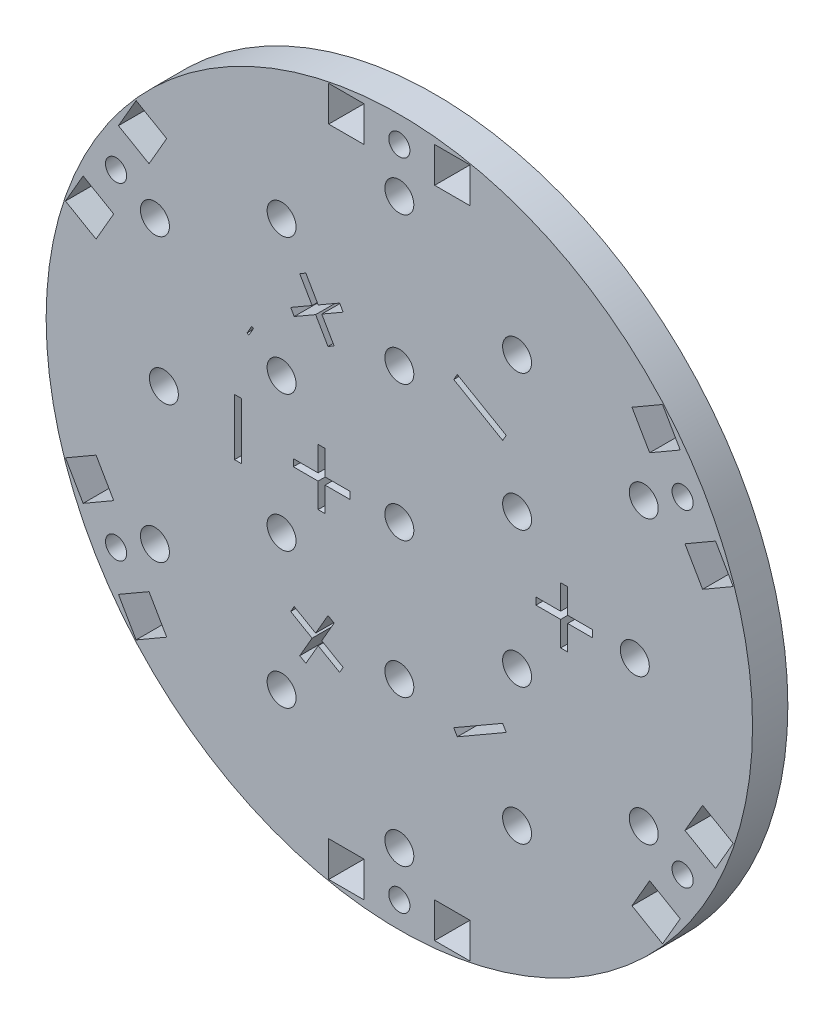
from build123d import *

# Parameters (mm, degrees)
BOSS_EXTRU_1_OUTLINE_R   = 50
BOSS_EXTRU_1_OUTLINE_W   = 5
BOSS_EXTRU_1_OUTLINE_H   = 5
BOSS_EXTRU_1_OUTLINE_R_2 = 2.05
BOSS_EXTRU_1_OUTLINE_R_3 = 1.5
BOSS_EXTRU_1_DEPTH       = 5
SKETCH3_W                = 1
SKETCH3_H                = 8
CUT_EXTRUDE2_DEPTH       = 10


# Read off the part's stored shape, not the designer's step: Boss.-Extru.1
with BuildPart() as part:
    # Boss.-Extru.1 outline → Boss.-Extru.1 (new body)
    with BuildSketch(Plane.XY):
        Circle(BOSS_EXTRU_1_OUTLINE_R)
        Polygon((-37.262039705, -33.060254038), (-39.762039705, -28.730127019), (-35.431912686, -26.230127019), (-32.931912686, -30.560254038), align=None, mode=Mode.SUBTRACT)
        with Locations((-7.5, -46.3)):
            Rectangle(BOSS_EXTRU_1_OUTLINE_W, BOSS_EXTRU_1_OUTLINE_H, mode=Mode.SUBTRACT)
        with Locations((-16.666666667, -28.867513459)):
            Circle(BOSS_EXTRU_1_OUTLINE_R_2, mode=Mode.SUBTRACT)
        with Locations((-40.096976195, -23.15)):
            Circle(BOSS_EXTRU_1_OUTLINE_R_3, mode=Mode.SUBTRACT)
        Polygon((-42.931912686, -13.239745962), (-40.431912686, -17.569872981), (-44.762039705, -20.069872981), (-47.262039705, -15.739745962), align=None, mode=Mode.SUBTRACT)
        with Locations((-34.597845014, -19.975075132)):
            Circle(BOSS_EXTRU_1_OUTLINE_R_2, mode=Mode.SUBTRACT)
        with Locations((-16.671397033, -9.625235564)):
            Circle(BOSS_EXTRU_1_OUTLINE_R_2, mode=Mode.SUBTRACT)
        with Locations((0, -46.3)):
            Circle(BOSS_EXTRU_1_OUTLINE_R_3, mode=Mode.SUBTRACT)
        with Locations((7.5, -46.3)):
            Rectangle(BOSS_EXTRU_1_OUTLINE_W, BOSS_EXTRU_1_OUTLINE_H, mode=Mode.SUBTRACT)
        with Locations((0, -39.950150265)):
            Circle(BOSS_EXTRU_1_OUTLINE_R_2, mode=Mode.SUBTRACT)
        with Locations((16.666666667, -28.867513459)):
            Circle(BOSS_EXTRU_1_OUTLINE_R_2, mode=Mode.SUBTRACT)
        Polygon((32.931912686, -30.560254038), (35.431912686, -26.230127019), (39.762039705, -28.730127019), (37.262039705, -33.060254038), align=None, mode=Mode.SUBTRACT)
        with Locations((0, -19.232757636)):
            Circle(BOSS_EXTRU_1_OUTLINE_R_2, mode=Mode.SUBTRACT)
        with Locations((16.666666667, -9.622504487)):
            Circle(BOSS_EXTRU_1_OUTLINE_R_2, mode=Mode.SUBTRACT)
        with Locations((34.597845014, -19.975075132)):
            Circle(BOSS_EXTRU_1_OUTLINE_R_2, mode=Mode.SUBTRACT)
        with Locations((40.096976195, -23.15)):
            Circle(BOSS_EXTRU_1_OUTLINE_R_3, mode=Mode.SUBTRACT)
        Polygon((47.262039705, -15.739745962), (44.762039705, -20.069872981), (40.431912686, -17.569872981), (42.931912686, -13.239745962), align=None, mode=Mode.SUBTRACT)
        with Locations((-33.333333333, 0)):
            Circle(BOSS_EXTRU_1_OUTLINE_R_2, mode=Mode.SUBTRACT)
        Polygon((-47.262039705, 15.739745962), (-44.762039705, 20.069872981), (-40.431912686, 17.569872981), (-42.931912686, 13.239745962), align=None, mode=Mode.SUBTRACT)
        with Locations((-40.096976195, 23.15)):
            Circle(BOSS_EXTRU_1_OUTLINE_R_3, mode=Mode.SUBTRACT)
        with Locations((-34.597845014, 19.975075132)):
            Circle(BOSS_EXTRU_1_OUTLINE_R_2, mode=Mode.SUBTRACT)
        with Locations((-16.671397032, 9.625235564)):
            Circle(BOSS_EXTRU_1_OUTLINE_R_2, mode=Mode.SUBTRACT)
        Polygon((-32.931912686, 30.560254038), (-35.431912686, 26.230127019), (-39.762039705, 28.730127019), (-37.262039705, 33.060254038), align=None, mode=Mode.SUBTRACT)
        with Locations((-16.666666667, 28.867513459)):
            Circle(BOSS_EXTRU_1_OUTLINE_R_2, mode=Mode.SUBTRACT)
        with Locations((-7.5, 46.3)):
            Rectangle(BOSS_EXTRU_1_OUTLINE_W, BOSS_EXTRU_1_OUTLINE_H, mode=Mode.SUBTRACT)
        Circle(BOSS_EXTRU_1_OUTLINE_R_2, mode=Mode.SUBTRACT)
        with Locations((16.669571796, 9.624181764)):
            Circle(BOSS_EXTRU_1_OUTLINE_R_2, mode=Mode.SUBTRACT)
        with Locations((0, 19.165334425)):
            Circle(BOSS_EXTRU_1_OUTLINE_R_2, mode=Mode.SUBTRACT)
        with Locations((33.333333333, 0)):
            Circle(BOSS_EXTRU_1_OUTLINE_R_2, mode=Mode.SUBTRACT)
        with Locations((34.597845014, 19.975075133)):
            Circle(BOSS_EXTRU_1_OUTLINE_R_2, mode=Mode.SUBTRACT)
        Polygon((42.931912686, 13.239745962), (40.431912686, 17.569872981), (44.762039705, 20.069872981), (47.262039705, 15.739745962), align=None, mode=Mode.SUBTRACT)
        with Locations((40.096976195, 23.15)):
            Circle(BOSS_EXTRU_1_OUTLINE_R_3, mode=Mode.SUBTRACT)
        with Locations((16.666666667, 28.867513459)):
            Circle(BOSS_EXTRU_1_OUTLINE_R_2, mode=Mode.SUBTRACT)
        with Locations((0, 39.950150265)):
            Circle(BOSS_EXTRU_1_OUTLINE_R_2, mode=Mode.SUBTRACT)
        with Locations((0, 46.3)):
            Circle(BOSS_EXTRU_1_OUTLINE_R_3, mode=Mode.SUBTRACT)
        with Locations((7.5, 46.3)):
            Rectangle(BOSS_EXTRU_1_OUTLINE_W, BOSS_EXTRU_1_OUTLINE_H, mode=Mode.SUBTRACT)
        Polygon((37.262039705, 33.060254038), (39.762039705, 28.730127019), (35.431912686, 26.230127019), (32.931912686, 30.560254038), align=None, mode=Mode.SUBTRACT)
    extrude(amount=BOSS_EXTRU_1_DEPTH)

    # Sketch3 → Cut-Extrude2 (cut)
    with BuildSketch(Plane.XY.offset(5)):
        with Locations((-22.833333333, 0)):
            Rectangle(SKETCH3_W, SKETCH3_H)
        Polygon((-13.233653965, 23.921361037), (-14.099679369, 23.421361037), (-12.349679369, 20.390272124), (-15.380768282, 18.640272124), (-14.880768282, 17.77424672), (-11.849679369, 19.52424672), (-10.099679369, 16.493157806), (-9.233653965, 16.993157806), (-10.983653965, 20.02424672), (-7.952565052, 21.77424672), (-8.452565052, 22.640272124), (-11.483653965, 20.890272124), align=None)
        Polygon((15.130768282, 18.207259422), (14.630768282, 17.341234018), (7.702565052, 21.341234018), (8.202565052, 22.207259422), align=None)
        Polygon((8.202565052, -22.207259422), (7.702565052, -21.341234018), (14.630768282, -17.341234018), (15.130768282, -18.207259422), align=None)
        Polygon((27.333333333, -0.5), (27.333333333, 0.5), (23.833333333, 0.5), (23.833333333, 4), (22.833333333, 4), (22.833333333, 0.5), (19.333333333, 0.5), (19.333333333, -0.5), (22.833333333, -0.5), (22.833333333, -4), (23.833333333, -4), (23.833333333, -0.5), align=None)
        Polygon((-14.099679369, -23.421361037), (-13.233653965, -23.921361037), (-11.483653965, -20.890272124), (-8.452565052, -22.640272124), (-7.952565052, -21.77424672), (-10.983653965, -20.02424672), (-9.233653965, -16.993157806), (-10.099679369, -16.493157806), (-11.849679369, -19.52424672), (-14.880768282, -17.77424672), (-15.380768282, -18.640272124), (-12.349679369, -20.390272124), align=None)
        Polygon((-7.005935602, -0.708643072), (-7.005935602, 0.291356928), (-10.505935602, 0.291356928), (-10.505935602, 3.791356928), (-11.505935602, 3.791356928), (-11.505935602, 0.291356928), (-15.005935602, 0.291356928), (-15.005935602, -0.708643072), (-11.505935602, -0.708643072), (-11.505935602, -4.208643072), (-10.505935602, -4.208643072), (-10.505935602, -0.708643072), align=None)
        Polygon((-20.645633013, 13.413868493), (-21.300480769, 12.280855673), (-21.552183494, 12.425987884), (-20.897335737, 13.559000705), align=None)
    extrude(amount=-CUT_EXTRUDE2_DEPTH, mode=Mode.SUBTRACT)


solid = part.part
